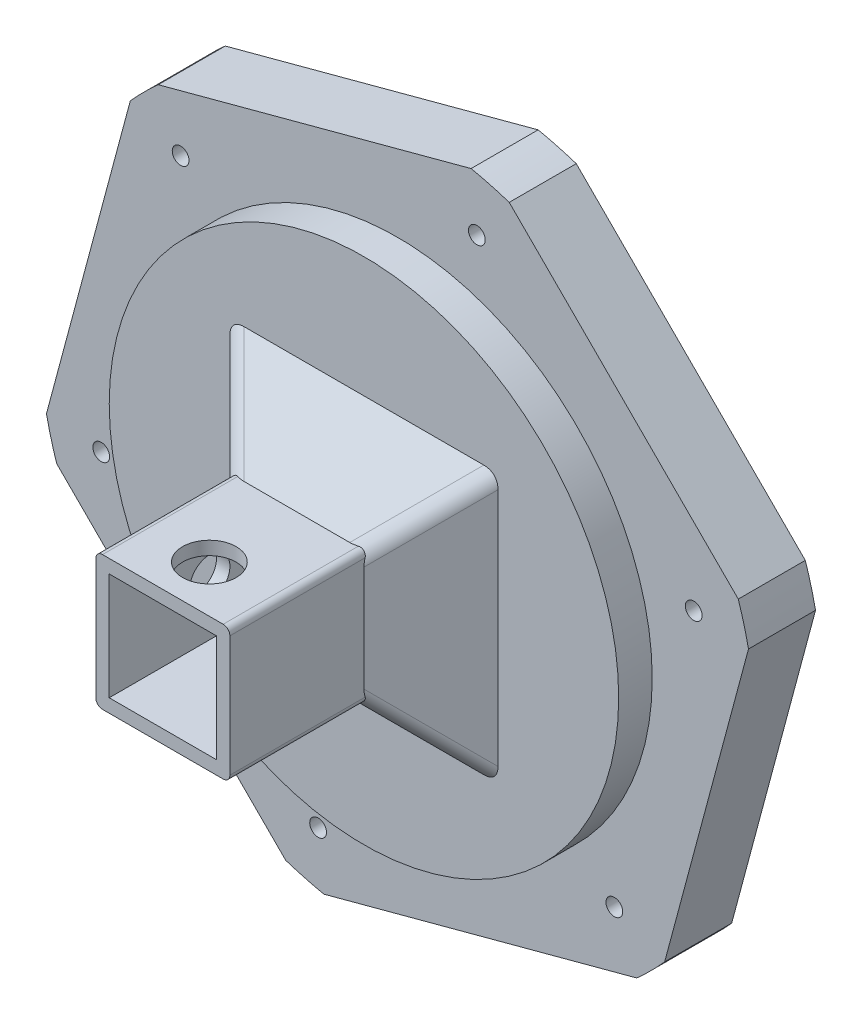
from build123d import *

# Parameters (mm, degrees)
SKETCH_1_R          = 53.5
EXTRUDE_1_DEPTH     = 10
SKETCH_2_R          = 38
EXTRUDE_2_DEPTH     = 5
SKETCH_3_W          = 20
SKETCH_3_H          = 20
SKETCH_3_W_2        = 16
SKETCH_3_H_2        = 16
EXTRUDE_3_DEPTH     = 30
SKETCH_4_R          = 3
CUT_EXTRUDE_1_DEPTH = 19
CHAMFER_1_SIZE      = 10
FILLET_1_R          = 3
FILLET_2_R          = 1
SKETCH_6_W          = 16
SKETCH_6_H          = 16
CUT_EXTRUDE_2_DEPTH = 35
CUT_EXTRUDE_3_DEPTH = 16
SKETCH_8_R          = 1.25
CUT_EXTRUDE_4_DEPTH = 20
SKETCH_9_R          = 4.75
CUT_EXTRUDE_5_DEPTH = 3
SKETCH_10_R         = 4
CUT_EXTRUDE_6_DEPTH = 5


with BuildPart() as part:
    # Эскиз1 → Бобышка-Вытянуть1 (new body)
    with BuildSketch(Plane.XY):
        Circle(SKETCH_1_R)
    extrude(amount=-EXTRUDE_1_DEPTH)

    # Эскиз2 → Бобышка-Вытянуть2 (add)
    with BuildSketch(Plane.XY):
        Circle(SKETCH_2_R)
    extrude(amount=EXTRUDE_2_DEPTH)

    # Эскиз3 → Бобышка-Вытянуть3 (add)
    with BuildSketch(Plane.XY.offset(5)):
        Rectangle(SKETCH_3_W, SKETCH_3_H)
        Rectangle(SKETCH_3_W_2, SKETCH_3_H_2, mode=Mode.SUBTRACT)
    extrude(amount=EXTRUDE_3_DEPTH)

    # Эскиз4 → Вырез-Вытянуть1 (cut)
    with BuildSketch(Plane.ZY.offset(10)):
        with Locations(Location((20, 0, 0), (0, 0, 270))):
            Circle(SKETCH_4_R)
    extrude(amount=-CUT_EXTRUDE_1_DEPTH, mode=Mode.SUBTRACT)

    # Фаска1
    chamfer_1_edges = [part.edges().sort_by_distance(p)[0] for p in [
        (10, 0, 5),
        (0, 10, 5),
        (-10, 0, 5),
        (0, -10, 5),
    ]]
    chamfer(chamfer_1_edges, length=CHAMFER_1_SIZE)

    # Скругление1
    fillet_1_edges = [part.edges().sort_by_distance(p)[0] for p in [
        (15, -15, 10),
        (-15, -15, 10),
        (15, 15, 10),
        (-15, 15, 10),
    ]]
    fillet(fillet_1_edges, radius=FILLET_1_R)

    # Fillet 2
    fillet_2_edges = [part.edges().sort_by_distance(p)[0] for p in [
        (-10, -10, 24.715796964),
        (-10, 10, 24.715796964),
        (10, 10, 24.715796964),
        (10, -10, 24.715796964),
    ]]
    fillet(fillet_2_edges, radius=FILLET_2_R)

    # Эскиз6 → Вырез-Вытянуть2 (cut)
    with BuildSketch(Plane.XY.offset(35)):
        Rectangle(SKETCH_6_W, SKETCH_6_H)
    extrude(amount=-CUT_EXTRUDE_2_DEPTH, mode=Mode.SUBTRACT)

    # Эскиз7 → Вырез-Вытянуть3 (cut)
    with BuildSketch(Plane.XY):
        with BuildLine():
            Line((-50.83668087, -16.669789385), (-16.669789385, -50.83668087))
            ThreePointArc((-16.669789385, -50.83668087), (-37.830212793, -37.830212793), (-50.83668087, -16.669789385))
        make_face()
        with BuildLine():
            Line((-39.854801518, 35.690962385), (-52.36075177, -10.981879352))
            ThreePointArc((-52.36075177, -10.981879352), (-51.677031706, 13.846818913), (-39.854801518, 35.690962385))
        make_face()
        with BuildLine():
            Line((10.981879352, 52.36075177), (-35.690962385, 39.854801518))
            ThreePointArc((-35.690962385, 39.854801518), (-13.846818913, 51.677031706), (10.981879352, 52.36075177))
        make_face()
        with BuildLine():
            Line((50.83668087, 16.669789385), (16.669789385, 50.83668087))
            ThreePointArc((16.669789385, 50.83668087), (37.830212793, 37.830212793), (50.83668087, 16.669789385))
        make_face()
        with BuildLine():
            Line((39.854801518, -35.690962385), (52.36075177, 10.981879352))
            ThreePointArc((52.36075177, 10.981879352), (51.677031706, -13.846818913), (39.854801518, -35.690962385))
        make_face()
        with BuildLine():
            Line((-10.981879352, -52.36075177), (35.690962385, -39.854801518))
            ThreePointArc((35.690962385, -39.854801518), (13.846818913, -51.677031706), (-10.981879352, -52.36075177))
        make_face()
    extrude(amount=-CUT_EXTRUDE_3_DEPTH, mode=Mode.SUBTRACT)

    # Эскиз8 → Вырез-Вытянуть4 (cut)
    with BuildSketch(Plane(origin=(0, 0, -10), x_dir=(-1, 0, 0), z_dir=(0, 0, -1))):
        with Locations((32.350135239, 32.350135239)):
            Circle(SKETCH_8_R)
        with Locations((44.191106553, -11.840971313)):
            Circle(SKETCH_8_R)
        with Locations((11.840971313, -44.191106553)):
            Circle(SKETCH_8_R)
        with Locations((-32.350135239, -32.350135239)):
            Circle(SKETCH_8_R)
        with Locations((-44.191106553, 11.840971313)):
            Circle(SKETCH_8_R)
        with Locations((-11.840971313, 44.191106553)):
            Circle(SKETCH_8_R)
    extrude(amount=-CUT_EXTRUDE_4_DEPTH, mode=Mode.SUBTRACT)

    # Эскиз9 → Вырез-Вытянуть5 (cut)
    with BuildSketch(Plane(origin=(0, 0, -10), x_dir=(-1, 0, 0), z_dir=(0, 0, -1))):
        with Locations((-11.840971313, 44.191106553)):
            Circle(SKETCH_9_R)
        with Locations((-44.191106553, 11.840971313)):
            Circle(SKETCH_9_R)
        with Locations((-32.350135239, -32.350135239)):
            Circle(SKETCH_9_R)
        with Locations((11.840971313, -44.191106553)):
            Circle(SKETCH_9_R)
        with Locations((44.191106553, -11.840971313)):
            Circle(SKETCH_9_R)
        with Locations((32.350135239, 32.350135239)):
            Circle(SKETCH_9_R)
    extrude(amount=-CUT_EXTRUDE_5_DEPTH, mode=Mode.SUBTRACT)

    # Fillet 2 2: read off the stored shape, not the designer's step
    # Fillet 2 2 outline → Fillet 2 2 (revolve, cut)
    with BuildSketch(Plane(origin=(-11.840971313, -44.191106553, 0), x_dir=(1, 0, 0), z_dir=(0, -1, 0))):
        Polygon((3.25, -7), (1.25, -5), (1.25, -7), align=None)
    revolve(axis=Axis((-11.840971313, -44.191106553, 0), (0, 0, 1)), mode=Mode.SUBTRACT)

    # Фаска3: read off the stored shape, not the designer's step
    # Фаска3 outline → Фаска3 (revolve, cut)
    with BuildSketch(Plane(origin=(32.350135239, -32.350135239, 0), x_dir=(1, 0, 0), z_dir=(0, -1, 0))):
        Polygon((3.25, -7), (1.25, -5), (1.25, -7), align=None)
    revolve(axis=Axis((32.350135239, -32.350135239, 0), (0, 0, 1)), mode=Mode.SUBTRACT)

    # Фаска4: read off the stored shape, not the designer's step
    # Фаска4 outline → Фаска4 (revolve, cut)
    with BuildSketch(Plane(origin=(44.191106553, 11.840971313, 0), x_dir=(1, 0, 0), z_dir=(0, -1, 0))):
        Polygon((3.25, -7), (1.25, -5), (1.25, -7), align=None)
    revolve(axis=Axis((44.191106553, 11.840971313, 0), (0, 0, 1)), mode=Mode.SUBTRACT)

    # Фаска5: read off the stored shape, not the designer's step
    # Фаска5 outline → Фаска5 (revolve, cut)
    with BuildSketch(Plane(origin=(11.840971313, 44.191106553, 0), x_dir=(1, 0, 0), z_dir=(0, -1, 0))):
        Polygon((3.25, -7), (1.25, -5), (1.25, -7), align=None)
    revolve(axis=Axis((11.840971313, 44.191106553, 0), (0, 0, 1)), mode=Mode.SUBTRACT)

    # Фаска6: read off the stored shape, not the designer's step
    # Фаска6 outline → Фаска6 (revolve, cut)
    with BuildSketch(Plane(origin=(-32.350135239, 32.350135239, 0), x_dir=(1, 0, 0), z_dir=(0, -1, 0))):
        Polygon((3.25, -7), (1.25, -5), (1.25, -7), align=None)
    revolve(axis=Axis((-32.350135239, 32.350135239, 0), (0, 0, 1)), mode=Mode.SUBTRACT)

    # Фаска7: read off the stored shape, not the designer's step
    # Фаска7 outline → Фаска7 (revolve, cut)
    with BuildSketch(Plane(origin=(-44.191106553, -11.840971313, 0), x_dir=(1, 0, 0), z_dir=(0, -1, 0))):
        Polygon((3.25, -7), (1.25, -5), (1.25, -7), align=None)
    revolve(axis=Axis((-44.191106553, -11.840971313, 0), (0, 0, 1)), mode=Mode.SUBTRACT)

    # Эскиз10 → Вырез-Вытянуть6 (cut)
    with BuildSketch(Plane(origin=(0, 10, 0), x_dir=(1, 0, 0), z_dir=(0, 1, 0))):
        with Locations(Location((-0.060660172, -28, 0), (0, 0, 270))):
            Circle(SKETCH_10_R)
    extrude(amount=-CUT_EXTRUDE_6_DEPTH, mode=Mode.SUBTRACT)


solid = part.part
